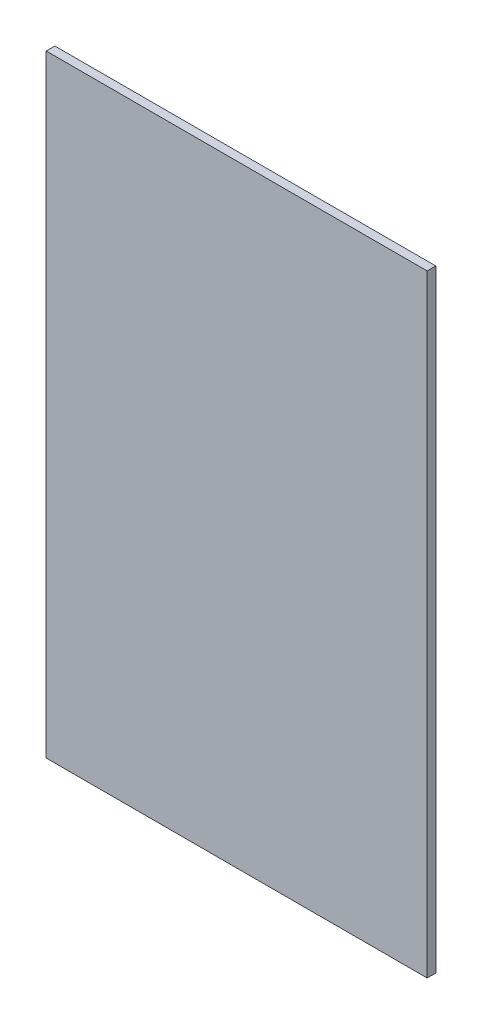
from build123d import *

# Parameters (mm, degrees)
SKETCH1_W           = 224.536
SKETCH1_H           = 139.7
BOSS_EXTRUDE1_DEPTH = 3.175


with BuildPart() as part:
    # Sketch1 → Boss-Extrude1 (new body)
    with BuildSketch(Plane(origin=(0, 0, 0), x_dir=(0, 1, 0), z_dir=(0, 0, 1))):
        Rectangle(SKETCH1_W, SKETCH1_H)
    extrude(amount=BOSS_EXTRUDE1_DEPTH)


solid = part.part
